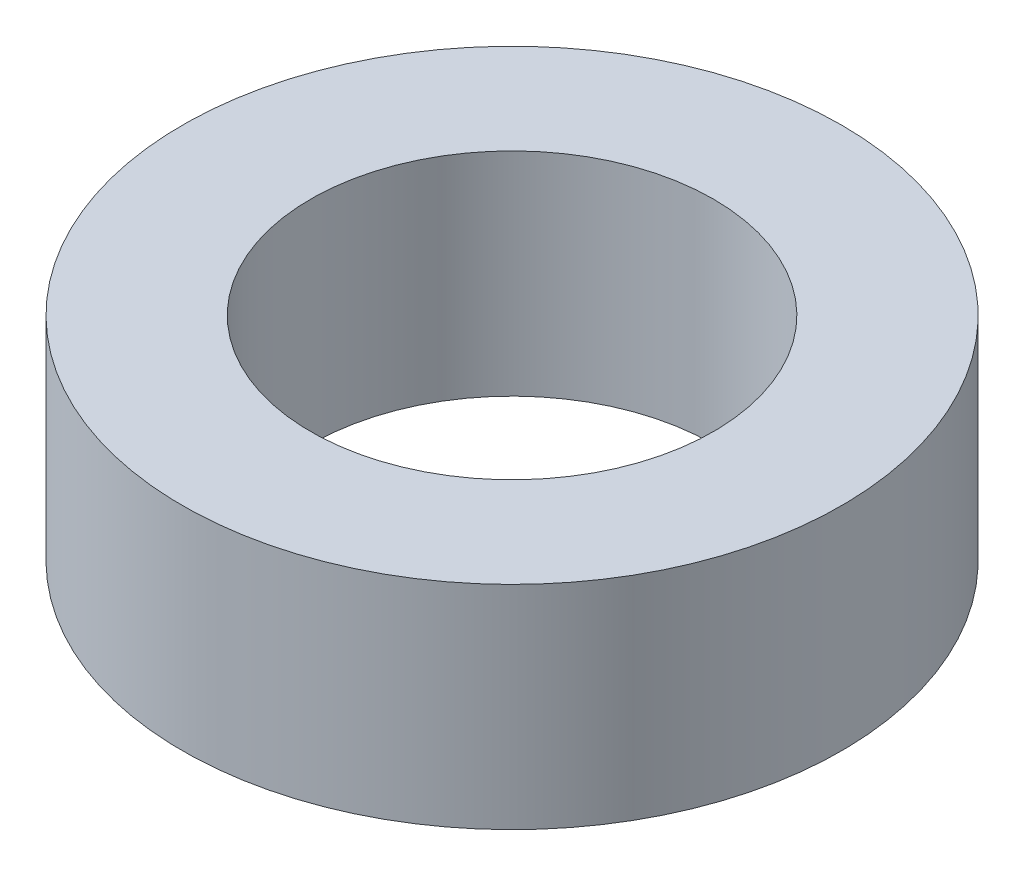
from build123d import *

# Parameters (mm, degrees)
SKETCH1_R           = 45
BOSS_EXTRUDE1_DEPTH = 29
SKETCH2_R           = 27.5
CUT_EXTRUDE1_DEPTH  = 70.93568474


with BuildPart() as part:
    # Sketch1 → Boss-Extrude1 (new body)
    with BuildSketch(Plane(origin=(0, 0, 0), x_dir=(1, 0, 0), z_dir=(0, 1, 0))):
        Circle(SKETCH1_R)
    extrude(amount=BOSS_EXTRUDE1_DEPTH)

    # Sketch2 → Cut-Extrude1 (cut, through all)
    with BuildSketch(Plane(origin=(0, 0, 0), x_dir=(1, 0, 0), z_dir=(0, 1, 0))):
        Circle(SKETCH2_R)
    extrude(amount=CUT_EXTRUDE1_DEPTH, mode=Mode.SUBTRACT)


solid = part.part
